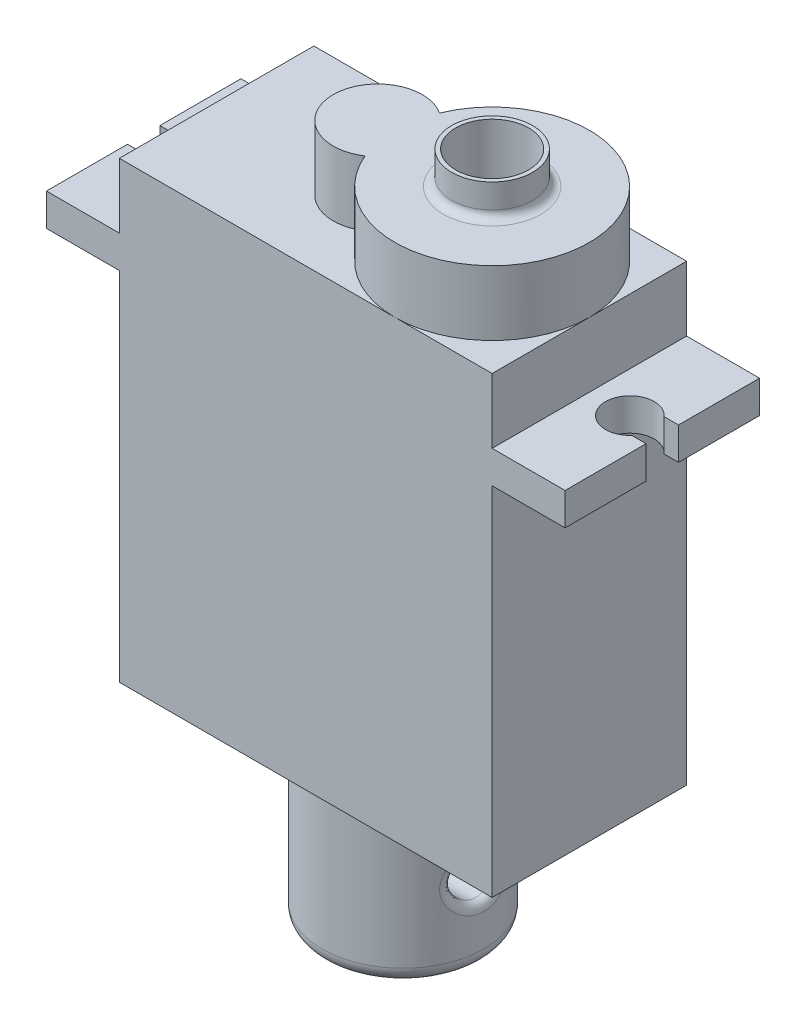
from build123d import *

# Parameters (mm, degrees)
SKETCH1_W           = 23
SKETCH1_H           = 12
BOSS_EXTRUDE1_DEPTH = 22
SKETCH2_W           = 32
SKETCH2_H           = 12
BOSS_EXTRUDE2_DEPTH = 2
CUT_EXTRUDE1_DEPTH  = 5
SKETCH3_W           = 23
SKETCH3_H           = 12
BOSS_EXTRUDE4_DEPTH = 4
BOSS_EXTRUDE5_DEPTH = 4
SKETCH6_R           = 2.5
SKETCH6_R_2         = 2.25
BOSS_EXTRUDE6_DEPTH = 2
CUT_EXTRUDE2_START  = -4
SKETCH7_R           = 2.25
CUT_EXTRUDE2_DEPTH  = 4
SKETCH8_R           = 5
BOSS_EXTRUDE7_DEPTH = 10
SKETCH9_R           = 1.5
CUT_EXTRUDE3_DEPTH  = 20
FILLET1_R           = 1
FILLET2_R           = 1
FILLET3_R           = 0.5
FILLET4_R           = 0.5


with BuildPart() as part:
    # Sketch1 → Boss-Extrude1 (new body)
    with BuildSketch(Plane(origin=(0, 0, 0), x_dir=(1, 0, 0), z_dir=(0, 1, 0))):
        Rectangle(SKETCH1_W, SKETCH1_H)
    extrude(amount=BOSS_EXTRUDE1_DEPTH)

    # Sketch2 → Boss-Extrude2 (add)
    with BuildSketch(Plane(origin=(0, 22, 0), x_dir=(1, 0, 0), z_dir=(0, 1, 0))):
        Rectangle(SKETCH2_W, SKETCH2_H)
    extrude(amount=BOSS_EXTRUDE2_DEPTH)

    # Sketch4 → Cut-Extrude1 (cut)
    with BuildSketch(Plane(origin=(0, 24, 0), x_dir=(1, 0, 0), z_dir=(0, 1, 0))):
        with BuildLine():
            Line((-16.63954717, 1), (-15.118033989, 1))
            ThreePointArc((-15.118033989, 1), (-12.5, 0), (-15.118033989, -1))
            Line((-15.118033989, -1), (-16.63954717, -1))
            Line((-16.63954717, -1), (-16.63954717, 1))
        make_face()
        with BuildLine():
            Line((15.118033989, 1), (17.121315796, 1))
            Line((17.121315796, 1), (17.121315796, -1))
            Line((17.121315796, -1), (15.118033989, -1))
            ThreePointArc((15.118033989, -1), (12.5, 0), (15.118033989, 1))
        make_face()
    extrude(amount=-CUT_EXTRUDE1_DEPTH, mode=Mode.SUBTRACT)

    # Sketch3 → Boss-Extrude4 (add)
    with BuildSketch(Plane(origin=(0, 24, 0), x_dir=(1, 0, 0), z_dir=(0, 1, 0))):
        Rectangle(SKETCH3_W, SKETCH3_H)
    extrude(amount=BOSS_EXTRUDE4_DEPTH)

    # Sketch5 → Boss-Extrude5 (add)
    with BuildSketch(Plane(origin=(0, 28, 0), x_dir=(1, 0, 0), z_dir=(0, 1, 0))):
        with BuildLine():
            ThreePointArc((-0.043232592, -2.296208273), (11.5, 0), (-0.043232592, 2.296208273))
            ThreePointArc((-0.043232592, 2.296208273), (-4.306483254, 0), (-0.043232592, -2.296208273))
        make_face()
    extrude(amount=BOSS_EXTRUDE5_DEPTH)

    # Sketch6 → Boss-Extrude6 (add)
    with BuildSketch(Plane(origin=(0, 32, 0), x_dir=(1, 0, 0), z_dir=(0, 1, 0))):
        with Locations(Location((5.5, 0, 0), (0, 0, 270))):
            Circle(SKETCH6_R)
        with Locations(Location((5.5, 0, 0), (0, 0, 270))):
            Circle(SKETCH6_R_2, mode=Mode.SUBTRACT)
    extrude(amount=BOSS_EXTRUDE6_DEPTH)

    # Sketch7 → Cut-Extrude2 (cut)
    with BuildSketch(Plane(origin=(0, 32, 0), x_dir=(1, 0, 0), z_dir=(0, 1, 0)).offset(CUT_EXTRUDE2_START)):
        with Locations(Location((5.5, 0, 0), (0, 0, 270))):
            Circle(SKETCH7_R)
    extrude(amount=CUT_EXTRUDE2_DEPTH, mode=Mode.SUBTRACT)

    # Sketch8 → Boss-Extrude7 (add)
    with BuildSketch(Plane.XZ):
        with Locations(Location((0, 0, 0), (0, 0, 270))):
            Circle(SKETCH8_R)
    extrude(amount=BOSS_EXTRUDE7_DEPTH)

    # Sketch9 → Cut-Extrude3 (cut)
    with BuildSketch(Plane(origin=(11.5, 0, 0), x_dir=(0, 0, -1), z_dir=(1, 0, 0))):
        with Locations((0, -5)):
            Circle(SKETCH9_R)
    extrude(amount=-CUT_EXTRUDE3_DEPTH, mode=Mode.SUBTRACT)

    # Fillet1
    fillet1_edges = [part.edges().sort_by_distance(p)[0] for p in [
        (0, -10, 5),
    ]]
    fillet(fillet1_edges, radius=FILLET1_R)

    # Fillet2
    fillet2_edges = [part.edges().sort_by_distance(p)[0] for p in [
        (0, 0, 5),
    ]]
    fillet(fillet2_edges, radius=FILLET2_R - 0.0001)  # a hair under: the kernel refuses the full size

    # Fillet3
    fillet3_edges = [part.edges().sort_by_distance(p)[0] for p in [
        (4.769696018, -4.999999997, 1.499999988),
        (-4.769696018, -4.999999997, 1.499999988),
    ]]
    fillet(fillet3_edges, radius=FILLET3_R)

    # Fillet4
    fillet4_edges = [part.edges().sort_by_distance(p)[0] for p in [
        (5.5, 32, -2.5),
    ]]
    fillet(fillet4_edges, radius=FILLET4_R)


solid = part.part
